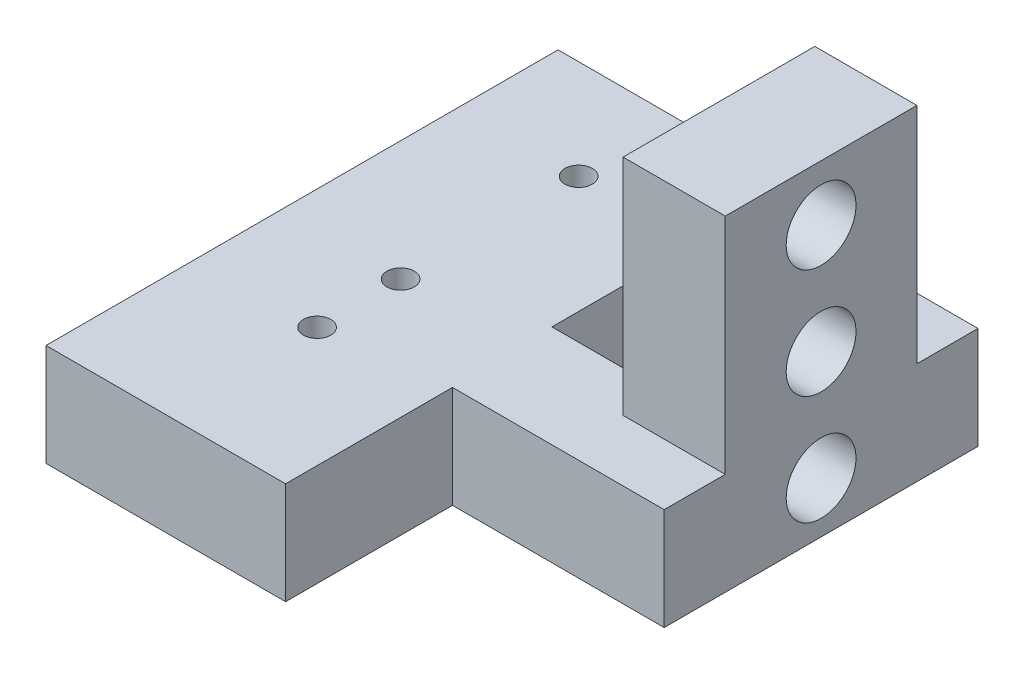
from build123d import *

# Parameters (mm, degrees)
SKETCH1_W           = 8.2
SKETCH1_H           = 8
BOSS_EXTRUDE1_DEPTH = 7.46
BOSS_EXTRUDE2_DEPTH = 16.34
SKETCH4_R           = 2.55
CUT_EXTRUDE1_DEPTH  = 43.142763317
CUT_EXTRUDE2_DEPTH  = 1.1
CUT_EXTRUDE4_REACH  = 42.752
SKETCH6_R           = 1


with BuildPart() as part:
    # Sketch1 → Boss-Extrude1 (new body)
    with BuildSketch(Plane(origin=(0, 0, 0), x_dir=(1, 0, 0), z_dir=(0, 1, 0))):
        Polygon((8.75, 11.46), (24.21, 11.46), (24.21, -11.46), (8.75, -11.46), (8.75, -23.65), (-8.75, -23.65), (-8.75, 13.75), (8.75, 13.75), align=None)
        with Locations((12.65, 0)):
            Rectangle(SKETCH1_W, SKETCH1_H, mode=Mode.SUBTRACT)
    extrude(amount=BOSS_EXTRUDE1_DEPTH)

    # Sketch3 → Boss-Extrude2 (add)
    with BuildSketch(Plane(origin=(0, 7.46, 0), x_dir=(1, 0, 0), z_dir=(0, 1, 0))):
        Polygon((16.75, 7), (24.21, 7), (24.21, -7), (16.75, -7), (16.75, -4), (16.75, 4), align=None)
    extrude(amount=BOSS_EXTRUDE2_DEPTH)

    # Sketch4 → Cut-Extrude1 (cut, through all)
    with BuildSketch(Plane.ZY.offset(-16.75)):
        with Locations((0, 3.73)):
            Circle(SKETCH4_R)
        with Locations((0, 11.73)):
            Circle(SKETCH4_R)
        with Locations((0, 19.73)):
            Circle(SKETCH4_R)
    extrude(amount=-CUT_EXTRUDE1_DEPTH, mode=Mode.SUBTRACT)

    # Sketch5 → Cut-Extrude2 (cut)
    with BuildSketch(Plane.XZ):
        with BuildLine():
            Line((-2.113983221, 14.966101695), (-3.606206671, 0.368644068))
            ThreePointArc((-3.606206671, 0.368644068), (-3.625, 0), (-3.606206671, -0.368644068))
            Line((-3.606206671, -0.368644068), (-2.113983221, -14.966101695))
            ThreePointArc((-2.113983221, -14.966101695), (0, -16.875), (2.113983221, -14.966101695))
            Line((2.113983221, -14.966101695), (3.606206671, -0.368644068))
            ThreePointArc((3.606206671, -0.368644068), (3.625, 0), (3.606206671, 0.368644068))
            Line((3.606206671, 0.368644068), (2.113983221, 14.966101695))
            ThreePointArc((2.113983221, 14.966101695), (0, 16.875), (-2.113983221, 14.966101695))
        make_face()
    extrude(amount=-CUT_EXTRUDE2_DEPTH, mode=Mode.SUBTRACT)

    # Sketch6 → Cut-Extrude4 (cut, up to next)
    with BuildSketch(Plane.XZ.offset(-1.1), mode=Mode.PRIVATE) as cut_extrude4_sk1:
        with Locations((0, 12.6)):
            Circle(SKETCH6_R)
    cut_extrude4_tool1 = extrude(cut_extrude4_sk1.sketch, amount=-CUT_EXTRUDE4_REACH, mode=Mode.PRIVATE) & part.part
    # Sketch6 → Cut-Extrude4 (cut, up to next)
    with BuildSketch(Plane.XZ.offset(-1.1), mode=Mode.PRIVATE) as cut_extrude4_sk2:
        with Locations((0, 6.5)):
            Circle(SKETCH6_R)
    cut_extrude4_tool2 = extrude(cut_extrude4_sk2.sketch, amount=-CUT_EXTRUDE4_REACH, mode=Mode.PRIVATE) & part.part
    # Sketch6 → Cut-Extrude4 (cut, up to next)
    with BuildSketch(Plane.XZ.offset(-1.1), mode=Mode.PRIVATE) as cut_extrude4_sk3:
        with Locations((0, -6.5)):
            Circle(SKETCH6_R)
    cut_extrude4_tool3 = extrude(cut_extrude4_sk3.sketch, amount=-CUT_EXTRUDE4_REACH, mode=Mode.PRIVATE) & part.part
    add(cut_extrude4_tool1.solids().sort_by_distance((0, 1.1, 12.6))[0], mode=Mode.SUBTRACT)
    add(cut_extrude4_tool2.solids().sort_by_distance((0, 1.1, 6.5))[0], mode=Mode.SUBTRACT)
    add(cut_extrude4_tool3.solids().sort_by_distance((0, 1.1, -6.5))[0], mode=Mode.SUBTRACT)


solid = part.part
